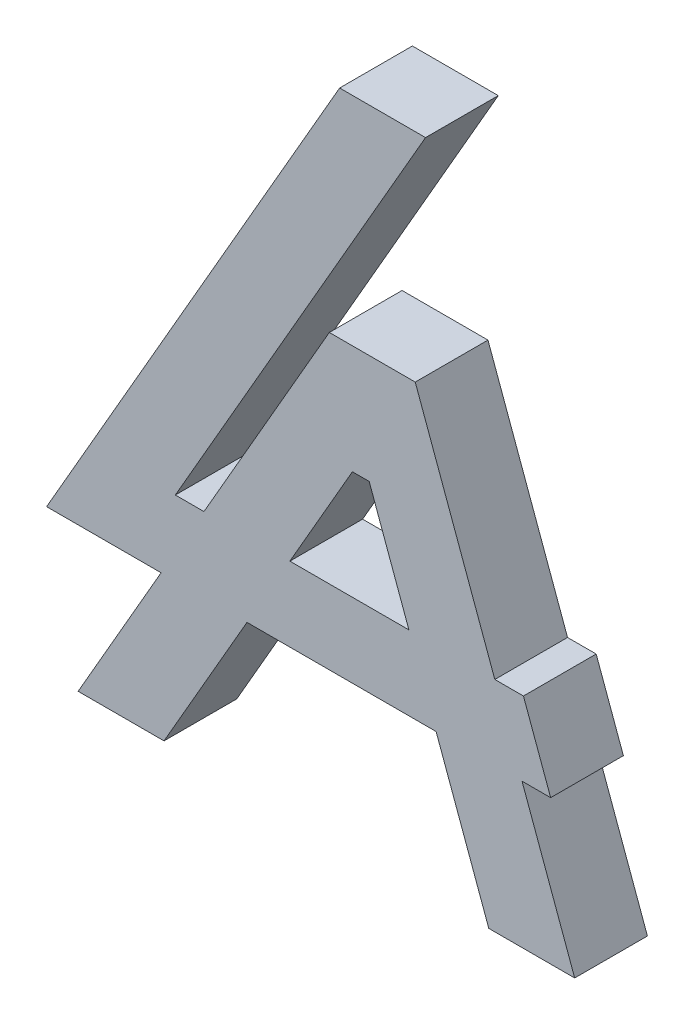
from build123d import *

# Parameters (mm, degrees)
BASE_FLANGE1_DEPTH = 12.7
CUT_EXTRUDE1_DEPTH = 120.869459796
SCALE1_SCALE       = 0.55


# Sheet-metal steps are written as plain solids
with BuildPart() as part:
    # Sketch2 → Base-Flange1 (new body)
    with BuildSketch(Plane.XY):
        Polygon((0, 0), (7.179503017, 0), (-7.310206248, -25.171495006), (7.689793752, -25.171495006), (22.179503017, 0), (55.200620493, 0), (64.398913039, -25.171495006), (79.398913039, -25.171495006), (70.200620493, 0), (75.200620493, 0), (70.450096018, 13), (65.450096018, 13), (51.553531117, 51.028504994), (36.553531117, 51.028504994), (14.662817791, 13), (9.662817791, 13), (53.353863276, 88.9), (38.353863276, 88.9), (-1.919318718, 18.937505869), (-12.820496983, 0), align=None)
    extrude(amount=-BASE_FLANGE1_DEPTH)

    # Sketch12 → Cut-Extrude1 (cut, through all)
    with BuildSketch(Plane.XY):
        Polygon((29.662817791, 13), (50.450096018, 13), (43.514747433, 31.978858458), (40.587800243, 31.978858458), align=None)
    extrude(amount=-CUT_EXTRUDE1_DEPTH, mode=Mode.SUBTRACT)


with BuildPart() as part_1:
    # Scale1: scaled about (0, 0, 0)
    add(part.part.scale(SCALE1_SCALE))


solid = part_1.part
